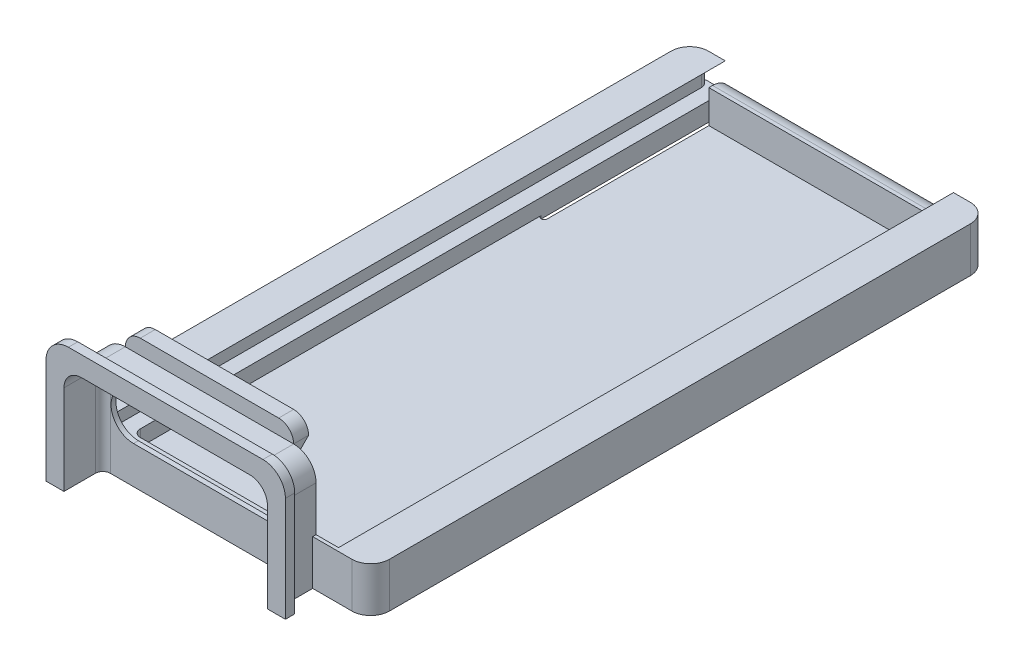
from build123d import *

# Parameters (mm, degrees)
BOSS_EXTRUDE1_DEPTH      = 1.25
SKETCH2_W                = 14.25
SKETCH2_H                = 15
BOSS_EXTRUDE2_DEPTH      = 4.6
FILLET1_R                = 3
SKETCH5_W                = 20
SKETCH5_H                = 82.2
BASE_PLATE_DEPTH         = 6
SLOT_CUT_DEPTH           = 82.2
REAR_TAB_DEPTH           = 4.4
REAR_TAB_DEPTH_BACK      = 0.4
SKETCH8_W                = 15.25
SKETCH8_H                = 3
SKETCH22_W               = 15.25
SKETCH22_H               = 3
FRONT_SUPPORT_RAIL_DEPTH = 2.1
SKETCH23_W               = 0.8
SKETCH23_H               = 25
BEND_SLOT_DEPTH          = 91.682082023
SKETCH20_W               = 7.75
SKETCH20_H               = 6
SKETCH20_W_2             = 4.75
BOSS_EXTRUDE3_DEPTH      = 0.45
FILLET6_R                = 2.5
CUT_EXTRUDE4_DEPTH       = 92.879282213
CUT_EXTRUDE5_DEPTH       = 5.2
FILLET5_R                = 1
FILLET7_R                = 0.4
BOSS_EXTRUDE4_DEPTH      = 2
CHAMFER1_SIZE            = 2
FILLET8_R                = 2


# Some blends are built 0.0001 mm under size
with BuildPart() as part:
    # Sketch1 → Boss-Extrude1 (new body)
    with BuildSketch(Plane.XY):
        Polygon((0, 0), (14, 0), (14, 17), (-2, 17), (-2, 0), align=None)
    extrude(amount=BOSS_EXTRUDE1_DEPTH)

    # Sketch2 → Boss-Extrude2 (add)
    with BuildSketch(Plane.XY):
        with Locations((5.125, 7.5)):
            Rectangle(SKETCH2_W, SKETCH2_H)
    extrude(amount=-BOSS_EXTRUDE2_DEPTH)

    # Fillet1
    fillet1_edges = [part.edges().sort_by_distance(p)[0] for p in [
        (12.25, 15, -2.3),
        (14, 17, 0.625),
    ]]
    fillet(fillet1_edges, radius=FILLET1_R)

    # Mirror1: part across plane


with BuildPart() as body_2:
    # Sketch5 → Base Plate (new body)
    with BuildSketch(Plane(origin=(0, 0, 0), x_dir=(1, 0, 0), z_dir=(0, 1, 0))):
        with Locations((10, 45.7)):
            Rectangle(SKETCH5_W, SKETCH5_H)
    extrude(amount=BASE_PLATE_DEPTH)

    # Sketch18 → Slot Cut (cut)
    with BuildSketch(Plane(origin=(0, 0, -86.8), x_dir=(-1, 0, 0), z_dir=(0, 0, -1))):
        Polygon((0, 0.4), (-15.25, 0.4), (-15.25, 2.5), (-17.25, 2.5), (-17.25, 4.5), (-15.25, 6), (0, 6), align=None)
    extrude(amount=-SLOT_CUT_DEPTH, mode=Mode.SUBTRACT)

    # Sketch8 → Rear Tab (add, two sides: drawn at the far end of the back side and taken through both)
    with BuildSketch(Plane(origin=(0, 0.4, 0), x_dir=(1, 0, 0), z_dir=(0, 1, 0)).offset(-REAR_TAB_DEPTH_BACK)):
        with Locations((7.625, 85.3)):
            Rectangle(SKETCH8_W, SKETCH8_H)
    extrude(amount=REAR_TAB_DEPTH + REAR_TAB_DEPTH_BACK)

    # Sketch22 → Front Support Rail (add)
    with BuildSketch(Plane(origin=(0, 0.4, 0), x_dir=(1, 0, 0), z_dir=(0, 1, 0))):
        with Locations((7.625, 6.1)):
            Rectangle(SKETCH22_W, SKETCH22_H)
    extrude(amount=FRONT_SUPPORT_RAIL_DEPTH)

    # Sketch23 → Bend Slot (cut, through all)
    with BuildSketch(Plane(origin=(0, 0, 0), x_dir=(1, 0, 0), z_dir=(0, 1, 0))):
        with Locations((14.85, 74.3)):
            Rectangle(SKETCH23_W, SKETCH23_H)
    extrude(amount=BEND_SLOT_DEPTH, mode=Mode.SUBTRACT)

    # Mirror2: body 2 across plane


with BuildPart() as part_1:
    add(part.part)
    add(part.part.mirror(Plane(origin=(-2, 0, 1.25), x_dir=(0, 0, 1), z_dir=(1, 0, 0))))



with BuildPart() as body_2_1:
    add(body_2.part)
    add(body_2.part.mirror(Plane(origin=(0, 6, -4.6), x_dir=(0, 0, 1), z_dir=(1, 0, 0))))


with BuildPart() as part_2:
    add(part_1.part)

    add(body_2_1.part)  # Boss-Extrude3 merges body 2
    # Sketch20 → Boss-Extrude3 (add)
    with BuildSketch(Plane.XY.offset(-4.6)):
        with Locations((16.125, 3)):
            Rectangle(SKETCH20_W, SKETCH20_H)
        with Locations((-17.625, 3)):
            Rectangle(SKETCH20_W_2, SKETCH20_H)
    extrude(amount=BOSS_EXTRUDE3_DEPTH)

    # Fillet6
    fillet6_edges = [part_2.edges().sort_by_distance(p)[0] for p in [
        (-20, 3, -4.15),
        (20, 3, -4.15),
        (20, 3, -86.8),
        (0, 4.8, -86.8),
        (-20, 3, -86.8),
    ]]
    fillet(fillet6_edges, radius=FILLET6_R)

    # Sketch15 → Cut-Extrude4 (cut, through all)
    with BuildSketch(Plane.XY.offset(1.25)):
        with BuildLine():
            Line((7.5, 5), (-11.5, 5))
            ThreePointArc((-11.5, 5), (-14.5, 8), (-11.5, 11))
            Line((-11.5, 11), (7.5, 11))
            ThreePointArc((7.5, 11), (10.5, 8), (7.5, 5))
        make_face()
    extrude(amount=-CUT_EXTRUDE4_DEPTH, mode=Mode.SUBTRACT)

    # Sketch16 → Cut-Extrude5 (cut)
    with BuildSketch(Plane.XY.offset(1.25)):
        with BuildLine():
            Line((-15.6, 0), (11.6, 0))
            Line((11.6, 0), (11.6, 12))
            ThreePointArc((11.6, 12), (10.911700936, 13.661700936), (9.25, 14.35))
            Line((9.25, 14.35), (-13.25, 14.35))
            ThreePointArc((-13.25, 14.35), (-14.911700936, 13.661700936), (-15.6, 12))
            Line((-15.6, 12), (-15.6, 0))
        make_face()
    extrude(amount=-CUT_EXTRUDE5_DEPTH, mode=Mode.SUBTRACT)

    # Fillet5
    # the kernel refuses this fillet: 1 mm, written as the material it adds along each edge
    with BuildSketch(Plane(origin=(9.25, 14.35, -3.95), x_dir=(0, -1, 0), z_dir=(-1, 0, 0))) as fillet5_piece_1:
        with BuildLine():
            CenterArc((FILLET5_R, FILLET5_R), FILLET5_R, 180, 90)
            Line((0, FILLET5_R), (0, 0))
            Line((0, 0), (FILLET5_R, 0))
        make_face()
    extrude(amount=22.5)
    with BuildSketch(Plane(origin=(-13.25, 12, -3.95), x_dir=(0, 1, 0), z_dir=(1, 0, 0))) as fillet5_piece_2:
        with BuildLine():
            CenterArc((2.35 - FILLET5_R, FILLET5_R), FILLET5_R, 270, 90)
            Line((2.35, FILLET5_R), (2.35, 0))
            Line((2.35, 0), (2.35 - FILLET5_R, 0))
        make_face()
    revolve(axis=Axis((-13.25, 12, -3.95), (0, 0, 1)), revolution_arc=90)
    with BuildSketch(Plane(origin=(-15.6, 12, -3.95), x_dir=(1, 0, 0), z_dir=(0, -1, 0))) as fillet5_piece_3:
        with BuildLine():
            CenterArc((FILLET5_R, FILLET5_R), FILLET5_R, 180, 90)
            Line((0, FILLET5_R), (0, 0))
            Line((0, 0), (FILLET5_R, 0))
        make_face()
    extrude(amount=12)
    with BuildSketch(Plane(origin=(11.6, 0, -3.95), x_dir=(0, 0, 1), z_dir=(0, 1, 0))) as fillet5_piece_4:
        with BuildLine():
            CenterArc((FILLET5_R, -FILLET5_R), FILLET5_R, 90, 90)
            Line((0, -FILLET5_R), (0, 0))
            Line((0, 0), (FILLET5_R, 0))
        make_face()
    extrude(amount=12)
    with BuildSketch(Plane(origin=(9.25, 12, -3.95), x_dir=(1, 0, 0), z_dir=(0, -1, 0))) as fillet5_piece_5:
        with BuildLine():
            CenterArc((2.35 - FILLET5_R, FILLET5_R), FILLET5_R, 270, 90)
            Line((2.35, FILLET5_R), (2.35, 0))
            Line((2.35, 0), (2.35 - FILLET5_R, 0))
        make_face()
    revolve(axis=Axis((9.25, 12, -3.95), (0, 0, 1)), revolution_arc=90)
    with BuildSketch(Plane(origin=(15.25, 0.4, -7.6), x_dir=(0, 0, -1), z_dir=(0, 1, 0))) as fillet5_piece_6:
        with BuildLine():
            CenterArc((FILLET5_R, FILLET5_R), FILLET5_R, 180, 90)
            Line((0, FILLET5_R), (0, 0))
            Line((0, 0), (FILLET5_R, 0))
        make_face()
    extrude(amount=2.1)
    with BuildSketch(Plane(origin=(-15.25, 0.4, -7.6), x_dir=(0, 0, -1), z_dir=(0, 1, 0))) as fillet5_piece_7:
        with BuildLine():
            CenterArc((FILLET5_R, -FILLET5_R), FILLET5_R, 90, 90)
            Line((0, -FILLET5_R), (0, 0))
            Line((0, 0), (FILLET5_R, 0))
        make_face()
    extrude(amount=2.1)
    # the kernel refuses this fillet: 1 mm, written as the material it takes off along each edge
    with BuildSketch(Plane(origin=(17.25, 2.5, -86.8), x_dir=(0.9759656656854916, -1.7336632852602407e-15, 0.21792434330077798), z_dir=(0, 1, 0))) as fillet5_2_piece_1_section:
        with BuildLine():
            CenterArc((1.237684498, -0.954173231), FILLET5_R, 72.587148881, 120)
            Line((0.261718832, -1.172097575), (0.164122266, -1.193890009))
            Line((0.164122266, -1.193890009), (-0.097596567, -0.021792434))
            Line((-0.097596567, -0.021792434), (-0.021792434, 0.097596567))
            ThreePointArc((-0.021792434, 0.097596567), (0.222198982, 0.152077652), (1.566864795, 0.095417323))
            Line((1.566864795, 0.095417323), (1.536939313, 0))
        make_face()
    fillet5_2_piece_1 = extrude(amount=5.842348283, mode=Mode.PRIVATE)
    fillet5_2_piece_1 = split(fillet5_2_piece_1, bisect_by=Plane(origin=(18.04936, 3.90048, -86.46679556), z_dir=(-0.5999999999999985, -0.8000000000000012, 0)), keep=Keep.TOP, mode=Mode.PRIVATE)
    add(fillet5_2_piece_1, mode=Mode.SUBTRACT)
    with BuildSketch(Plane(origin=(-17.25, 2.5, -86.8), x_dir=(-0.9759656656854916, -1.7336632852602407e-15, 0.21792434330077798), z_dir=(0, 1, 0))) as fillet5_2_piece_2_section:
        with BuildLine():
            CenterArc((1.237684498, 0.954173231), FILLET5_R, 167.412851119, 120)
            Line((0.261718832, 1.172097575), (0.164122266, 1.193890009))
            Line((0.164122266, 1.193890009), (-0.097596567, 0.021792434))
            Line((-0.097596567, 0.021792434), (-0.021792434, -0.097596567))
            ThreePointArc((-0.021792434, -0.097596567), (0.222198982, -0.152077652), (1.566864795, -0.095417323))
            Line((1.566864795, -0.095417323), (1.536939313, 0))
        make_face()
    fillet5_2_piece_2 = extrude(amount=5.842348283, mode=Mode.PRIVATE)
    fillet5_2_piece_2 = split(fillet5_2_piece_2, bisect_by=Plane(origin=(-18.04936, 3.90048, -86.46679556), z_dir=(0.5999999999999985, -0.8000000000000012, 0)), keep=Keep.TOP, mode=Mode.PRIVATE)
    add(fillet5_2_piece_2, mode=Mode.SUBTRACT)

    # Fillet7
    fillet7_edges = [part_2.edges().sort_by_distance(p)[0] for p in [
        (-14.45, 0.2, -61.8),
        (-15.25, 0.2, -61.8),
        (14.45, 0.2, -61.8),
        (15.25, 0.2, -61.8),
    ]]
    fillet(fillet7_edges, radius=FILLET7_R - 0.0001)  # a hair under: the kernel refuses the full size

    # Sketch24 → Boss-Extrude4 (add)
    with BuildSketch(Plane(origin=(0, 0, -4.6), x_dir=(-1, 0, 0), z_dir=(0, 0, -1))):
        Polygon((-9.25, 15), (-9.25, 17), (13.25, 17), (13.25, 15), (13.25, 13), (-9.25, 13), align=None)
    extrude(amount=BOSS_EXTRUDE4_DEPTH)

    # Chamfer1
    chamfer1_edges = [part_2.edges().sort_by_distance(p)[0] for p in [
        (-2, 13, -6.6),
    ]]
    chamfer(chamfer1_edges, length=CHAMFER1_SIZE - 0.0001)  # a hair under: the kernel refuses the full size

    # Fillet8
    fillet8_edges = [part_2.edges().sort_by_distance(p)[0] for p in [
        (-13.25, 17, -5.6),
        (9.25, 17, -5.6),
    ]]
    fillet(fillet8_edges, radius=FILLET8_R)


solid = part_2.part
